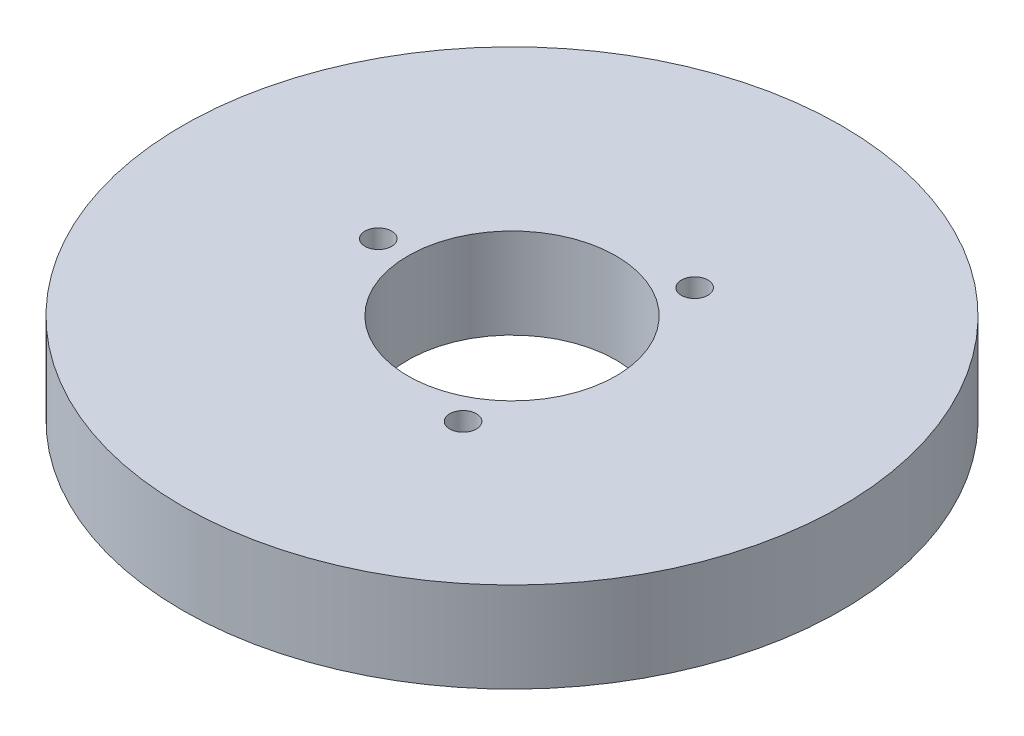
from build123d import *

# Parameters (mm, degrees)
SKETCH1_R           = 47.5
BOSS_EXTRUDE1_DEPTH = 13
SKETCH2_R           = 15
CUT_EXTRUDE1_DEPTH  = 69.421487853
SKETCH3_R           = 1.916893701
CUT_EXTRUDE2_DEPTH  = 7.942004184
CIRPATTERN1_COUNT   = 3


with BuildPart() as part:
    # Sketch1 → Boss-Extrude1 (new body)
    with BuildSketch(Plane(origin=(0, 0, 0), x_dir=(1, 0, 0), z_dir=(0, 1, 0))):
        Circle(SKETCH1_R)
    extrude(amount=BOSS_EXTRUDE1_DEPTH)

    # Sketch2 → Cut-Extrude1 (cut, through all)
    with BuildSketch(Plane(origin=(0, 0, 0), x_dir=(1, 0, 0), z_dir=(0, 1, 0))):
        Circle(SKETCH2_R)
    extrude(amount=CUT_EXTRUDE1_DEPTH, mode=Mode.SUBTRACT)

    # Sketch3 → Cut-Extrude2 (cut)
    with BuildSketch(Plane(origin=(0, 13, 0), x_dir=(1, 0, 0), z_dir=(0, 1, 0))):
        with Locations((-19.271353756, 0)):
            Circle(SKETCH3_R)
    cut_extrude2 = extrude(amount=-CUT_EXTRUDE2_DEPTH, mode=Mode.SUBTRACT)

    # CirPattern1: Cut-Extrude2 ×3 about axis
    cirpattern1_axis = Axis((0, 0, 0), (0, 1, 0))
    for i in range(1, CIRPATTERN1_COUNT):
        add(cut_extrude2.rotate(cirpattern1_axis, i * 360 / CIRPATTERN1_COUNT), mode=Mode.SUBTRACT)


solid = part.part
